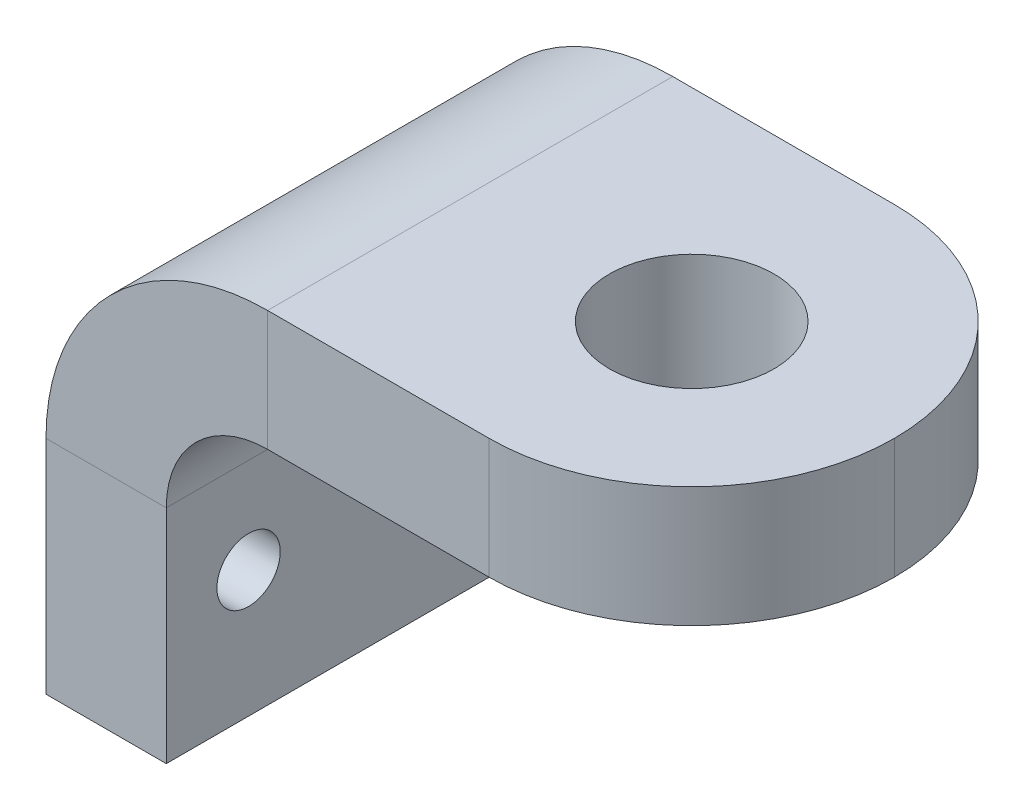
from build123d import *

# Parameters (mm, degrees)
BASE_FLANGE1_DEPTH         = 64
BREAK_CORNER1_START        = 51
BREAK_CORNER1_DEPTH        = 19
F_9_0_9_DIAMETER_HOLE1_D   = 26
F_10_0_10_DIAMETER_HOLE1_D = 10


# Read off the part's stored shape, not the designer's step: Break-Corner1
# Sheet-metal steps are written as plain solids
with BuildPart() as part:
    # Sketch1 → Base-Flange1 (new body)
    with BuildSketch(Plane.XY):
        with BuildLine():
            Line((0, 0), (0, 35))
            ThreePointArc((0, 35), (10.251262658, 59.748737342), (35, 70))
            Line((35, 70), (102, 70))
            Line((102, 70), (102, 51))
            Line((102, 51), (35, 51))
            ThreePointArc((35, 51), (23.686291501, 46.313708499), (19, 35))
            Line((19, 35), (19, 0))
            Line((19, 0), (0, 0))
        make_face()
    extrude(amount=BASE_FLANGE1_DEPTH)

    # Break-Corner1 outline → Break-Corner1 (cut)
    with BuildSketch(Plane(origin=(0, 0, 0), x_dir=(1, 0, 0), z_dir=(0, 1, 0)).offset(BREAK_CORNER1_START)):
        with BuildLine():
            Line((102, -64), (102, -32))
            ThreePointArc((102, -32), (92.627416998, -54.627416998), (70, -64))
            Line((70, -64), (102, -64))
        make_face()
        with BuildLine():
            ThreePointArc((70, 0), (92.627416998, -9.372583002), (102, -32))
            Line((102, -32), (102, 0))
            Line((102, 0), (70, 0))
        make_face()
    extrude(amount=BREAK_CORNER1_DEPTH, mode=Mode.SUBTRACT)

    # Ø9.0 (9) Diameter Hole1 (through all)
    with Locations(Plane(origin=(70, 70, 32), x_dir=(0, 0, 1), z_dir=(0, 1, 0))):
        with Locations((0, 0)):
            Hole(F_9_0_9_DIAMETER_HOLE1_D / 2)

    # Ø10.0 (10) Diameter Hole1 (through all)
    with Locations(Plane.ZY):
        with Locations((13, 20), (51, 20)):
            Hole(F_10_0_10_DIAMETER_HOLE1_D / 2)


solid = part.part
